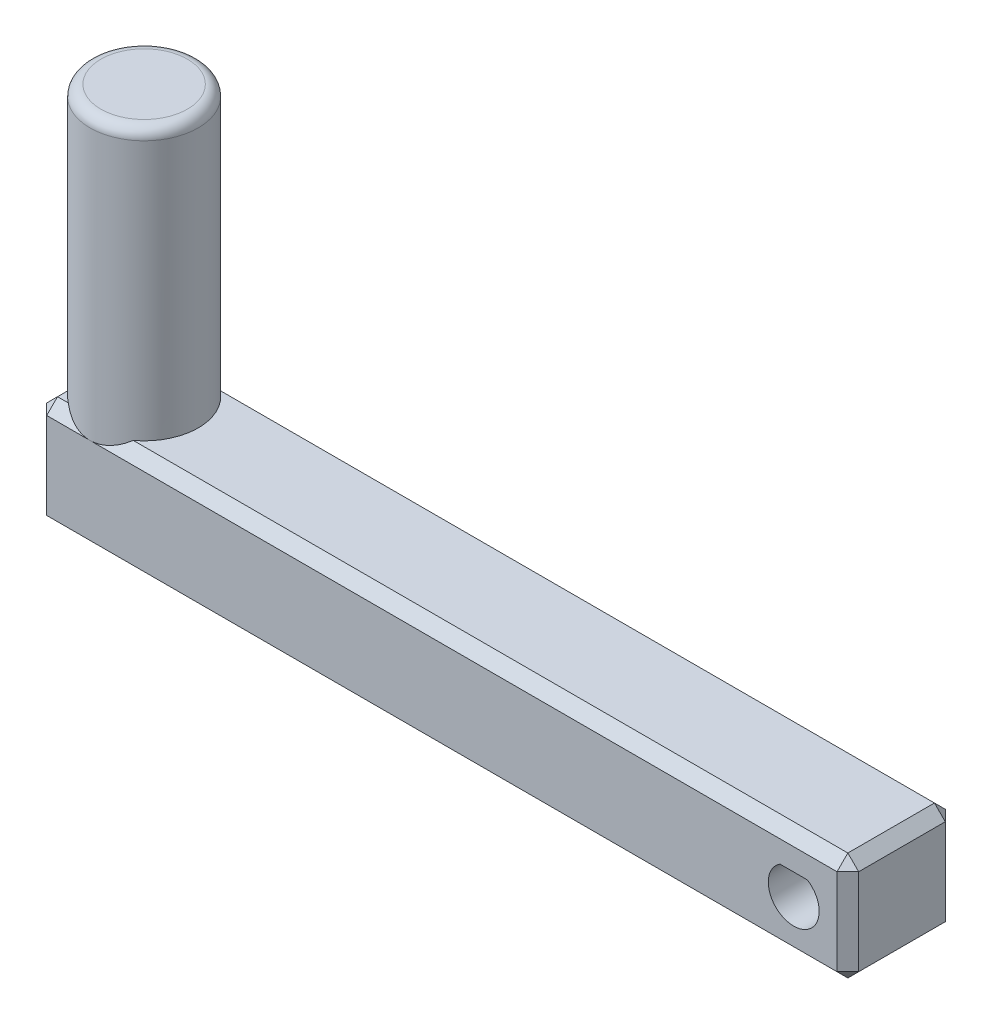
from build123d import *

# Parameters (mm, degrees)
SKETCH8_W           = 75
SKETCH8_H           = 10
BOSS_EXTRUDE5_DEPTH = 10
SKETCH9_R           = 5
BOSS_EXTRUDE7_DEPTH = 25
CUT_EXTRUDE1_DEPTH  = 84.366660003
CHAMFER1_SIZE       = 1
FILLET1_R           = 1


with BuildPart() as part:
    # Sketch8 → Boss-Extrude5 (new body)
    with BuildSketch(Plane(origin=(0, 0, 0), x_dir=(1, 0, 0), z_dir=(0, 1, 0))):
        with Locations((-37.5, -5)):
            Rectangle(SKETCH8_W, SKETCH8_H)
    extrude(amount=BOSS_EXTRUDE5_DEPTH)

    # Sketch9 → Boss-Extrude7 (add)
    with BuildSketch(Plane(origin=(0, 10, 0), x_dir=(1, 0, 0), z_dir=(0, 1, 0))):
        with Locations(Location((-70, -5, 0), (0, 0, 270))):
            Circle(SKETCH9_R)
    extrude(amount=BOSS_EXTRUDE7_DEPTH)

    # Sketch13 → Cut-Extrude1 (cut, through all)
    with BuildSketch(Plane.XY.offset(10)):
        with BuildLine():
            Line((-3.73, 6.977270846), (-6.27, 6.977270846))
            ThreePointArc((-6.27, 6.977270846), (-6.126499001, 2.937598487), (-2.65, 5))
            ThreePointArc((-2.65, 5), (-2.937598487, 6.126499001), (-3.73, 6.977270846))
        make_face()
    extrude(amount=-CUT_EXTRUDE1_DEPTH, mode=Mode.SUBTRACT)

    # Chamfer1
    # the kernel refuses this chamfer: 1 mm, written as the material it takes off along each edge
    with BuildSketch(Plane(origin=(-74.333333333, 9.333333333, 0.666666667), x_dir=(-0.7071067811865476, 0, 0.7071067811865475), z_dir=(-0.5773502691896257, 0.5773502691896256, -0.5773502691896258)), Plane(origin=(-74.333333333, 9.333333333, 9.333333333), x_dir=(0, 0.7071067811865475, -0.7071067811865475), z_dir=(-0.5773502691896258, 0.5773502691896258, 0.5773502691896258)), Plane(origin=(-0.666666667, 9.333333333, 9.333333333), x_dir=(0.7071067811865479, 0, -0.7071067811865471), z_dir=(0.5773502691896254, 0.577350269189626, 0.577350269189626)), Plane(origin=(-74.333333333, 0.666666667, 0.666666667), x_dir=(0, -0.7071067811865476, 0.7071067811865476), z_dir=(-0.5773502691896256, -0.5773502691896258, -0.5773502691896258)), Plane(origin=(-0.666666667, 0.666666667, 0.666666667), x_dir=(0.7071067811865476, 0, 0.7071067811865475), z_dir=(0.5773502691896257, -0.5773502691896257, -0.5773502691896258))) as chamfer1_piece_1:
        Polygon((-0.707106781, -0.40824829), (0.707106781, -0.40824829), (0, 0.816496581), align=None)
    extrude(amount=1.270170592, mode=Mode.SUBTRACT)
    with BuildSketch(Plane(origin=(-0.666666667, 9.333333333, 0.666666667), x_dir=(0.7071067811865476, 0, 0.7071067811865475), z_dir=(0.5773502691896257, 0.5773502691896257, -0.5773502691896258)), Plane(origin=(-74.333333333, 0.666666667, 9.333333333), x_dir=(0, -0.7071067811865475, -0.7071067811865476), z_dir=(-0.5773502691896256, -0.5773502691896258, 0.5773502691896257)), Plane(origin=(-0.666666667, 0.666666667, 9.333333333), x_dir=(0.7071067811865479, 0, -0.7071067811865471), z_dir=(0.5773502691896253, -0.577350269189626, 0.5773502691896258))) as chamfer1_piece_2:
        Polygon((-0.707106781, 0.40824829), (0.707106781, 0.40824829), (0, -0.816496581), align=None)
    extrude(amount=1.270170592, mode=Mode.SUBTRACT)
    with BuildSketch(Plane(origin=(-75, 10, -2.571682988), x_dir=(-0.0274958766105822, -0.999621916911297, 0), z_dir=(0, 0, 1))) as chamfer1_piece_3_section:
        Polygon((CHAMFER1_SIZE * 0.999621916911, CHAMFER1_SIZE * 0.0274958766106), (-CHAMFER1_SIZE * 0.0274958766106, CHAMFER1_SIZE * 0.999621916911), (0, 0), align=None)
    chamfer1_piece_3 = extrude(amount=7.571682988, mode=Mode.PRIVATE)
    chamfer1_piece_3 = chamfer1_piece_3 - Plane(origin=(-70, 9.64391603, 5), x_dir=(0, 0, 1), z_dir=(0, -1, 0)) * Cylinder(5, 20, mode=Mode.PRIVATE)
    add(chamfer1_piece_3, mode=Mode.SUBTRACT)
    with BuildSketch(Plane(origin=(-77.571682988, 10, 10), x_dir=(0, -0.9996219169112968, 0.027495876610585647), z_dir=(1, 0, 0))) as chamfer1_piece_4_section:
        Polygon((CHAMFER1_SIZE * 0.999621916911, CHAMFER1_SIZE * 0.0274958766106), (-CHAMFER1_SIZE * 0.0274958766106, CHAMFER1_SIZE * 0.999621916911), (0, 0), align=None)
    chamfer1_piece_4 = extrude(amount=7.571682988, mode=Mode.PRIVATE)
    chamfer1_piece_4 = chamfer1_piece_4 - Plane(origin=(-70, 9.64391603, 5), x_dir=(0, 0, 1), z_dir=(0, -1, 0)) * Cylinder(5, 20, mode=Mode.PRIVATE)
    add(chamfer1_piece_4, mode=Mode.SUBTRACT)
    with BuildSketch(Plane(origin=(-69.999999992, 10, 0), x_dir=(0, -0.9996219169112968, -0.0274958766105864), z_dir=(-1, 0, 0))) as chamfer1_piece_5_section:
        Polygon((CHAMFER1_SIZE * 0.999621916911, CHAMFER1_SIZE * 0.0274958766106), (-CHAMFER1_SIZE * 0.0274958766106, CHAMFER1_SIZE * 0.999621916911), (0, 0), align=None)
    chamfer1_piece_5 = extrude(amount=7.571682996, mode=Mode.PRIVATE)
    chamfer1_piece_5 = chamfer1_piece_5 - Plane(origin=(-70, 9.643916029, 5), x_dir=(0, 0, 1), z_dir=(0, -1, 0)) * Cylinder(5, 20, mode=Mode.PRIVATE)
    add(chamfer1_piece_5, mode=Mode.SUBTRACT)
    with BuildSketch(Plane(origin=(-75, 10, 5), x_dir=(-0.0274958766105822, -0.999621916911297, 0), z_dir=(0, 0, 1))) as chamfer1_piece_6_section:
        Polygon((CHAMFER1_SIZE * 0.999621916911, CHAMFER1_SIZE * 0.0274958766106), (-CHAMFER1_SIZE * 0.0274958766106, CHAMFER1_SIZE * 0.999621916911), (0, 0), align=None)
    chamfer1_piece_6 = extrude(amount=7.571682988, mode=Mode.PRIVATE)
    chamfer1_piece_6 = chamfer1_piece_6 - Plane(origin=(-70, 9.643916029, 5), x_dir=(0, 0, 1), z_dir=(0, -1, 0)) * Cylinder(5, 20, mode=Mode.PRIVATE)
    add(chamfer1_piece_6, mode=Mode.SUBTRACT)
    with BuildSketch(Plane(origin=(-70, 10, 10), x_dir=(0, 0.027495876610585647, -0.9996219169112968), z_dir=(1, 0, 0))) as chamfer1_piece_7_section:
        Polygon((CHAMFER1_SIZE * 0.999621916911, -CHAMFER1_SIZE * 0.0274958766106), (-CHAMFER1_SIZE * 0.0274958766106, -CHAMFER1_SIZE * 0.999621916911), (0, 0), align=None)
    chamfer1_piece_7 = extrude(amount=72.571682988, mode=Mode.PRIVATE)
    chamfer1_piece_7 = chamfer1_piece_7 - Plane(origin=(-70, 9.665551568, 5), x_dir=(0, 0, 1), z_dir=(0, -1, 0)) * Cylinder(5, 150, mode=Mode.PRIVATE)
    add(chamfer1_piece_7, mode=Mode.SUBTRACT)
    with BuildSketch(Plane(origin=(0, 10, 12.571682988), x_dir=(0.027495876610586414, -0.9996219169112968, 0), z_dir=(0, 0, -1)), Plane(origin=(-75, 0, -2.571682988), x_dir=(0.9996219169112968, -0.027495876610586483, 0), z_dir=(0, 0, 1)), Plane(origin=(0, -2.571682988, 10), x_dir=(0.02749587661058629, 0, -0.9996219169112968), z_dir=(0, 1, 0)), Plane(origin=(0, -2.571682988, 0), x_dir=(-0.9996219169112968, 0, -0.02749587661058625), z_dir=(0, 1, 0))) as chamfer1_piece_8:
        Polygon((CHAMFER1_SIZE * 0.999621916911, CHAMFER1_SIZE * 0.0274958766106), (-CHAMFER1_SIZE * 0.0274958766106, CHAMFER1_SIZE * 0.999621916911), (0, 0), align=None)
    extrude(amount=15.143365976, mode=Mode.SUBTRACT)
    with BuildSketch(Plane(origin=(-77.571682988, 0, 10), x_dir=(0, -0.02749587661058639, -0.9996219169112968), z_dir=(1, 0, 0))) as chamfer1_piece_9:
        Polygon((CHAMFER1_SIZE * 0.999621916911, CHAMFER1_SIZE * 0.0274958766106), (-CHAMFER1_SIZE * 0.0274958766106, CHAMFER1_SIZE * 0.999621916911), (0, 0), align=None)
    extrude(amount=80.143365976, mode=Mode.SUBTRACT)
    with BuildSketch(Plane(origin=(2.571682988, 0, 0), x_dir=(0, 0.9996219169112968, -0.027495876610586382), z_dir=(-1, 0, 0))) as chamfer1_piece_10:
        Polygon((CHAMFER1_SIZE * 0.999621916911, -CHAMFER1_SIZE * 0.0274958766106), (-CHAMFER1_SIZE * 0.0274958766106, -CHAMFER1_SIZE * 0.999621916911), (0, 0), align=None)
    extrude(amount=80.143365976, mode=Mode.SUBTRACT)
    with BuildSketch(Plane(origin=(0, 0, 12.571682988), x_dir=(0.027495876610586393, 0.9996219169112968, 0), z_dir=(0, 0, -1)), Plane(origin=(-75, -2.571682988, 10), x_dir=(-0.0274958766105822, 0, -0.999621916911297), z_dir=(0, 1, 0)), Plane(origin=(-75, -2.571682988, 0), x_dir=(0.9996219169112968, 0, -0.0274958766105866), z_dir=(0, 1, 0))) as chamfer1_piece_11:
        Polygon((CHAMFER1_SIZE * 0.999621916911, -CHAMFER1_SIZE * 0.0274958766106), (-CHAMFER1_SIZE * 0.0274958766106, -CHAMFER1_SIZE * 0.999621916911), (0, 0), align=None)
    extrude(amount=15.143365976, mode=Mode.SUBTRACT)
    with BuildSketch(Plane(origin=(2.571682988, 10, 0), x_dir=(0, -0.9996219169112968, -0.0274958766105864), z_dir=(-1, 0, 0))) as chamfer1_piece_12_section:
        Polygon((CHAMFER1_SIZE * 0.999621916911, CHAMFER1_SIZE * 0.0274958766106), (-CHAMFER1_SIZE * 0.0274958766106, CHAMFER1_SIZE * 0.999621916911), (0, 0), align=None)
    chamfer1_piece_12 = extrude(amount=72.571682979, mode=Mode.PRIVATE)
    chamfer1_piece_12 = chamfer1_piece_12 - Plane(origin=(-70, 9.665551567, 5), x_dir=(0, 0, 1), z_dir=(0, -1, 0)) * Cylinder(5, 150, mode=Mode.PRIVATE)
    add(chamfer1_piece_12, mode=Mode.SUBTRACT)

    # Fillet1
    fillet1_edges = [part.edges().sort_by_distance(p)[0] for p in [
        (-70, 35, 0),
    ]]
    fillet(fillet1_edges, radius=FILLET1_R)


solid = part.part
